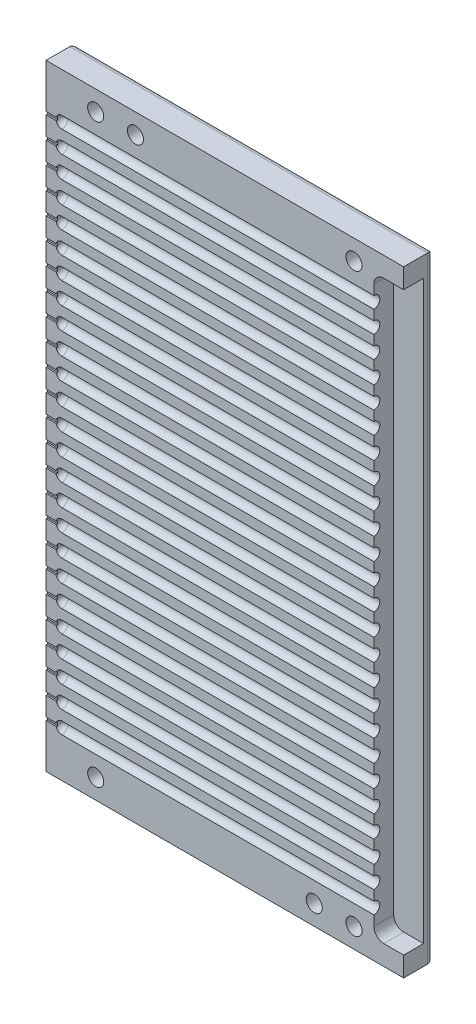
from build123d import *

# Parameters (mm, degrees)
SKETCH_1_W             = 180
SKETCH_1_H             = 310
EXTRUDE_1_DEPTH        = 15
PATTERN_LINEAR_1_COUNT = 25
PATTERN_LINEAR_1_PITCH = 11
SKETCH_4_W             = 15
SKETCH_4_H             = 290
CUT_EXTRUDE_2_DEPTH    = 10
SKETCH_6_W             = 0.7
SKETCH_6_H             = 1.5
CUT_EXTRUDE_3_DEPTH    = 180
SKETCH_7_R             = 4.05
CUT_EXTRUDE_4_DEPTH    = 180.861057486
SKETCH_7_3_R           = 4.05
CUT_EXTRUDE_5_DEPTH    = 180.861057486
FILLET_1_R             = 3
FILLET_2_R             = 5


# Read off the part's stored shape, not the designer's step: Вырез-Повернуть1
with BuildPart() as part:
    # Эскиз1 → Бобышка-Вытянуть1 (new body)
    with BuildSketch(Plane.XY):
        Rectangle(SKETCH_1_W, SKETCH_1_H)
    extrude(amount=EXTRUDE_1_DEPTH)

    # Вырез-Повернуть1 outline → Вырез-Повернуть1 (revolve, cut)
    with BuildSketch(Plane(origin=(0, 132, 15), x_dir=(0, 1, 0), z_dir=(0, 0, -1))):
        with BuildLine():
            Line((0, 75), (0, -85))
            ThreePointArc((0, -85), (2.121320344, -84.121320344), (3, -82))
            Line((3, -82), (3, 75))
            Line((3, 75), (0, 75))
        make_face()
    cut_revolve_1 = revolve(axis=Axis((0, 132, 15), (1, 0, 0)), mode=Mode.SUBTRACT)

    # Линейный массив1: Вырез-Повернуть1 ×25
    with Locations(*[(0, -i * PATTERN_LINEAR_1_PITCH, 0) for i in range(1, PATTERN_LINEAR_1_COUNT)]):
        add(cut_revolve_1, mode=Mode.SUBTRACT)

    # Эскиз4 → Вырез-Вытянуть2 (cut)
    with BuildSketch(Plane.XY.offset(15)):
        with Locations((82.5, 0)):
            Rectangle(SKETCH_4_W, SKETCH_4_H)
    extrude(amount=-CUT_EXTRUDE_2_DEPTH, mode=Mode.SUBTRACT)

    # Эскиз6 → Вырез-Вытянуть3 (cut)
    with BuildSketch(Plane.ZY.offset(90)):
        with Locations((14.65, 132)):
            Rectangle(SKETCH_6_W, SKETCH_6_H)
        with Locations((14.65, 121)):
            Rectangle(SKETCH_6_W, SKETCH_6_H)
        with Locations((14.65, 110)):
            Rectangle(SKETCH_6_W, SKETCH_6_H)
        with Locations((14.65, 99)):
            Rectangle(SKETCH_6_W, SKETCH_6_H)
        with Locations((14.65, 88)):
            Rectangle(SKETCH_6_W, SKETCH_6_H)
        with Locations((14.65, 77)):
            Rectangle(SKETCH_6_W, SKETCH_6_H)
        with Locations((14.65, 66)):
            Rectangle(SKETCH_6_W, SKETCH_6_H)
        with Locations((14.65, 55)):
            Rectangle(SKETCH_6_W, SKETCH_6_H)
        with Locations((14.65, 44)):
            Rectangle(SKETCH_6_W, SKETCH_6_H)
        with Locations((14.65, 33)):
            Rectangle(SKETCH_6_W, SKETCH_6_H)
        with Locations((14.65, 22)):
            Rectangle(SKETCH_6_W, SKETCH_6_H)
        with Locations((14.65, 11)):
            Rectangle(SKETCH_6_W, SKETCH_6_H)
        with Locations((14.65, 0)):
            Rectangle(SKETCH_6_W, SKETCH_6_H)
        with Locations((14.65, -11)):
            Rectangle(SKETCH_6_W, SKETCH_6_H)
        with Locations((14.65, -22)):
            Rectangle(SKETCH_6_W, SKETCH_6_H)
        with Locations((14.65, -33)):
            Rectangle(SKETCH_6_W, SKETCH_6_H)
        with Locations((14.65, -44)):
            Rectangle(SKETCH_6_W, SKETCH_6_H)
        with Locations((14.65, -55)):
            Rectangle(SKETCH_6_W, SKETCH_6_H)
        with Locations((14.65, -66)):
            Rectangle(SKETCH_6_W, SKETCH_6_H)
        with Locations((14.65, -77)):
            Rectangle(SKETCH_6_W, SKETCH_6_H)
        with Locations((14.65, -88)):
            Rectangle(SKETCH_6_W, SKETCH_6_H)
        with Locations((14.65, -99)):
            Rectangle(SKETCH_6_W, SKETCH_6_H)
        with Locations((14.65, -110)):
            Rectangle(SKETCH_6_W, SKETCH_6_H)
        with Locations((14.65, -121)):
            Rectangle(SKETCH_6_W, SKETCH_6_H)
        with Locations((14.65, -132)):
            Rectangle(SKETCH_6_W, SKETCH_6_H)
    extrude(amount=-CUT_EXTRUDE_3_DEPTH, mode=Mode.SUBTRACT)

    # Эскиз7 → Вырез-Вытянуть4 (cut, through all)
    with BuildSketch(Plane.XY.offset(15)):
        with Locations((-65, -145)):
            Circle(SKETCH_7_R)
        with Locations((-65, 145)):
            Circle(SKETCH_7_R)
        with Locations((65, -145)):
            Circle(SKETCH_7_R)
        with Locations((65, 145)):
            Circle(SKETCH_7_R)
    extrude(amount=-CUT_EXTRUDE_4_DEPTH, mode=Mode.SUBTRACT)

    # Эскиз7<3> → Вырез-Вытянуть5 (cut, through all)
    with BuildSketch(Plane.XY.offset(15)):
        with Locations((45, -145)):
            Circle(SKETCH_7_3_R)
        with Locations((-45, 145)):
            Circle(SKETCH_7_3_R)
    extrude(amount=-CUT_EXTRUDE_5_DEPTH, mode=Mode.SUBTRACT)

    # Скругление1
    fillet_1_edges = [part.edges().sort_by_distance(p)[0] for p in [
        (0, -155, 0),
        (-90, 0, 0),
        (0, 155, 0),
        (90, 0, 0),
    ]]
    fillet(fillet_1_edges, radius=FILLET_1_R)

    # Скругление2
    fillet_2_edges = [part.edges().sort_by_distance(p)[0] for p in [
        (75, -145, 10),
        (75, 145, 10),
    ]]
    fillet(fillet_2_edges, radius=FILLET_2_R)


solid = part.part
